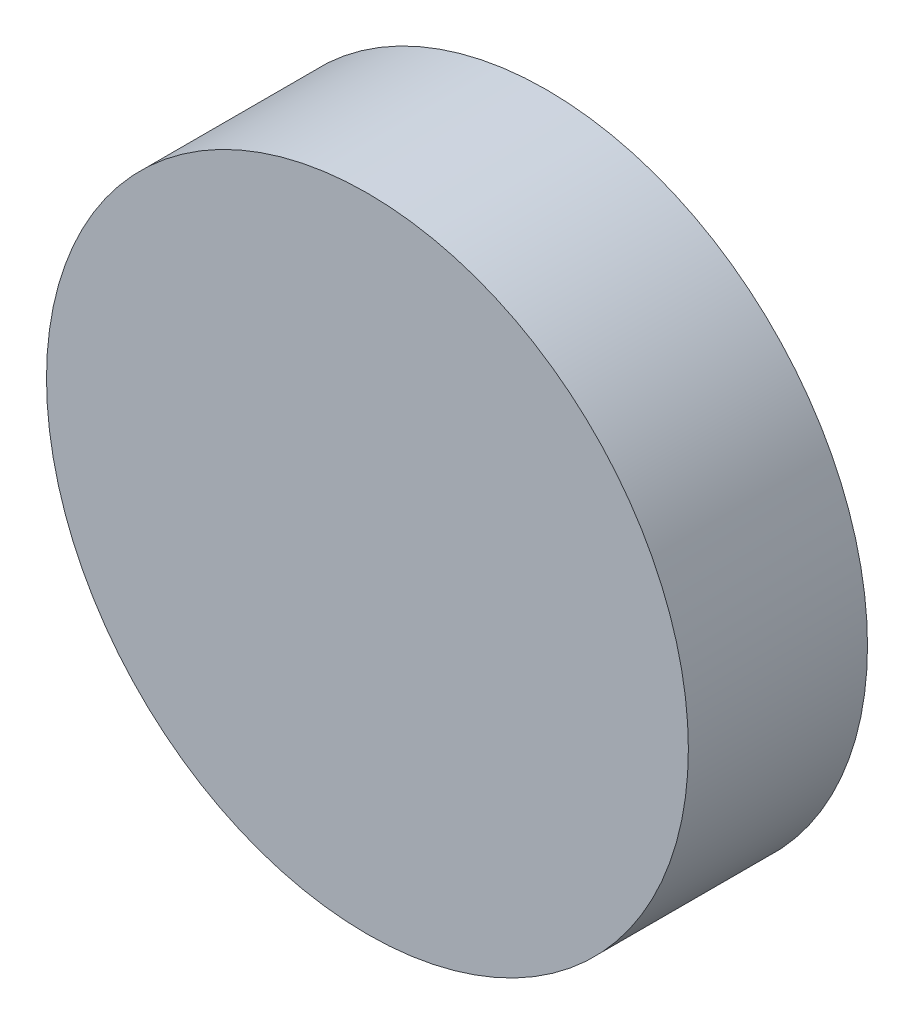
from build123d import *

# Parameters (mm, degrees)
ESQUISSE1_R        = 10.75
BOSS_EXTRU_1_DEPTH = 6
ESQUISSE3_R        = 0.7
BOSS_EXTRU_2_DEPTH = 3


with BuildPart() as part:
    # Esquisse1 → Boss.-Extru.1 (new body)
    with BuildSketch(Plane.XY):
        Circle(ESQUISSE1_R)
    extrude(amount=BOSS_EXTRU_1_DEPTH)

    # Esquisse3 → Boss.-Extru.2 (add)
    with BuildSketch(Plane(origin=(0, 0, 0), x_dir=(-1, 0, 0), z_dir=(0, 0, -1))):
        with Locations((-2.5, 0)):
            Circle(ESQUISSE3_R)
        with Locations((2.5, 0)):
            Circle(ESQUISSE3_R)
    extrude(amount=BOSS_EXTRU_2_DEPTH)


solid = part.part
